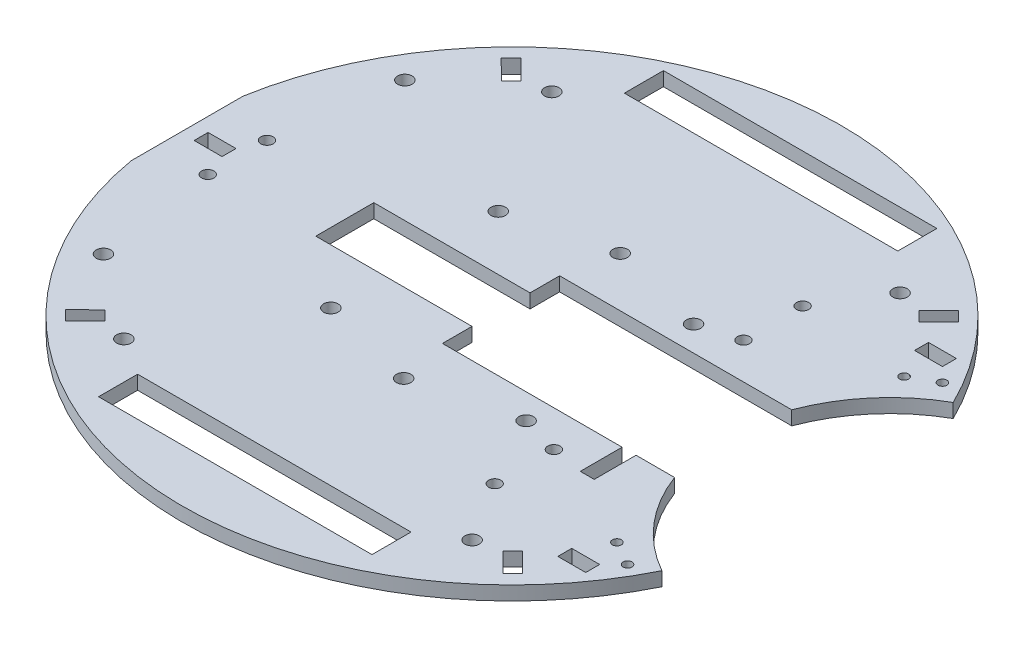
from build123d import *

# Parameters (mm, degrees)
SKETCH1_R           = 1.397
SKETCH1_R_2         = 1.651
SKETCH1_R_3         = 1.016
SKETCH1_W           = 62.23
SKETCH1_H           = 8.89
SKETCH1_W_2         = 6.35
SKETCH1_H_2         = 3.175
BOSS_EXTRUDE1_DEPTH = 3.175


with BuildPart() as part:
    # Sketch1 → Boss-Extrude1 (new body)
    with BuildSketch(Plane(origin=(0, 0, 0), x_dir=(1, 0, 0), z_dir=(0, 1, 0))):
        with BuildLine():
            Line((38.407265908, 13.335), (41.582265908, 13.335))
            Line((41.582265908, 13.335), (50.342102347, 13.335))
            ThreePointArc((50.342102347, 13.335), (57.058059725, 24.74076345), (67.270928268, 33.160552015))
            ThreePointArc((67.270928268, 33.160552015), (-10.756431789, 74.224653419), (-73.916912814, 12.7))
            Line((-73.916912814, 12.7), (-73.916912814, -12.7))
            ThreePointArc((-73.916912814, -12.7), (-10.756431789, -74.224653419), (67.270928268, -33.160552015))
            ThreePointArc((67.270928268, -33.160552015), (60.584216496, -28.355013333), (55.086193863, -22.225))
            ThreePointArc((55.086193863, -22.225), (52.41895011, -17.937530518), (50.342102347, -13.335))
            Line((50.342102347, -13.335), (46.281265908, -13.335))
            Line((46.281265908, -13.335), (41.582265908, -13.335))
            Line((41.582265908, -13.335), (41.582265908, -22.86))
            Line((41.582265908, -22.86), (38.407265908, -22.86))
            Line((38.407265908, -22.86), (38.407265908, -13.335))
            Line((38.407265908, -13.335), (-2.486734092, -13.335))
            Line((-2.486734092, -13.335), (-2.486734092, -6.604))
            Line((-2.486734092, -6.604), (-38.046734092, -6.604))
            Line((-38.046734092, -6.604), (-38.046734092, 6.604))
            Line((-38.046734092, 6.604), (-2.486734092, 6.604))
            Line((-2.486734092, 6.604), (-2.486734092, 13.335))
            Line((-2.486734092, 13.335), (38.407265908, 13.335))
        make_face()
        with Locations((-62.486912814, 6.731)):
            Circle(SKETCH1_R, mode=Mode.SUBTRACT)
        with Locations((-62.486912814, -6.731)):
            Circle(SKETCH1_R, mode=Mode.SUBTRACT)
        with Locations((-39.626912814, -48.698461806)):
            Circle(SKETCH1_R_2, mode=Mode.SUBTRACT)
        with Locations((39.626912814, -48.698461806)):
            Circle(SKETCH1_R_2, mode=Mode.SUBTRACT)
        with Locations((39.626912814, 48.698461806)):
            Circle(SKETCH1_R_2, mode=Mode.SUBTRACT)
        with Locations((0, -24.638)):
            Circle(SKETCH1_R_2, mode=Mode.SUBTRACT)
        with Locations((-39.626912814, 48.698461806)):
            Circle(SKETCH1_R_2, mode=Mode.SUBTRACT)
        with Locations((0, 24.638)):
            Circle(SKETCH1_R_2, mode=Mode.SUBTRACT)
        with Locations((31.115, -35.031303096)):
            Circle(SKETCH1_R, mode=Mode.SUBTRACT)
        with Locations((-58.676912814, 34.29)):
            Circle(SKETCH1_R_2, mode=Mode.SUBTRACT)
        with Locations((62.141053559, -35.830642926)):
            Circle(SKETCH1_R_3, mode=Mode.SUBTRACT)
        with Locations((56.570777105, -32.679132142)):
            Circle(SKETCH1_R_3, mode=Mode.SUBTRACT)
        with Locations((-58.676912814, -34.29)):
            Circle(SKETCH1_R_2, mode=Mode.SUBTRACT)
        with Locations((31.115, -21.569303096)):
            Circle(SKETCH1_R, mode=Mode.SUBTRACT)
        with Locations((31.115, 35.031303096)):
            Circle(SKETCH1_R, mode=Mode.SUBTRACT)
        with Locations((31.115, 21.569303096)):
            Circle(SKETCH1_R, mode=Mode.SUBTRACT)
        with Locations((62.141053559, 35.830642926)):
            Circle(SKETCH1_R_3, mode=Mode.SUBTRACT)
        with Locations((56.570777105, 32.679132142)):
            Circle(SKETCH1_R_3, mode=Mode.SUBTRACT)
        with Locations((22.278265908, 19.05)):
            Circle(SKETCH1_R_2, mode=Mode.SUBTRACT)
        with Locations((22.278265908, -19.05)):
            Circle(SKETCH1_R_2, mode=Mode.SUBTRACT)
        with Locations((-22.171734092, -19.05)):
            Circle(SKETCH1_R_2, mode=Mode.SUBTRACT)
        with Locations((-22.171734092, 19.05)):
            Circle(SKETCH1_R_2, mode=Mode.SUBTRACT)
        with Locations((0, -58.526303096)):
            Rectangle(SKETCH1_W, SKETCH1_H, mode=Mode.SUBTRACT)
        with Locations((0, 61.144461806)):
            Rectangle(SKETCH1_W, SKETCH1_H, mode=Mode.SUBTRACT)
        with Locations((55.791053559, -40.593142926)):
            Rectangle(SKETCH1_W_2, SKETCH1_H_2, mode=Mode.SUBTRACT)
        with Locations((55.791053559, 40.593142926)):
            Rectangle(SKETCH1_W_2, SKETCH1_H_2, mode=Mode.SUBTRACT)
        Polygon((45.267258816, -47.332558145), (49.766095322, -51.813960837), (52.006796668, -49.564542584), (47.507960162, -45.083139892), align=None, mode=Mode.SUBTRACT)
        Polygon((-45.267258816, -47.332558145), (-47.507960162, -45.083139892), (-52.006796668, -49.564542584), (-49.766095322, -51.813960837), align=None, mode=Mode.SUBTRACT)
        Polygon((-47.507960162, 45.083139892), (-52.006796668, 49.564542584), (-49.766095322, 51.813960837), (-45.267258816, 47.332558145), align=None, mode=Mode.SUBTRACT)
        Polygon((47.507960162, 45.083139892), (52.006796668, 49.564542584), (49.766095322, 51.813960837), (45.267258816, 47.332558145), align=None, mode=Mode.SUBTRACT)
        with Locations((-67.566912814, 0)):
            Rectangle(SKETCH1_W_2, SKETCH1_H_2, mode=Mode.SUBTRACT)
    extrude(amount=BOSS_EXTRUDE1_DEPTH)


solid = part.part
